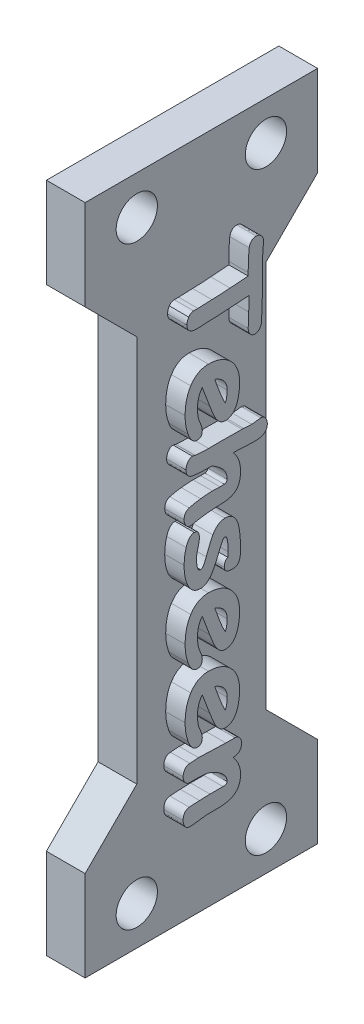
from build123d import *

# Parameters (mm, degrees)
SKETCH1_W           = 52.000002935
SKETCH1_H           = 18.000001088
SKETCH1_R           = 1.599502817
BOSS_EXTRUDE1_DEPTH = 2.999998629
CUT_EXTRUDE1_DEPTH  = 84.68851942
BOSS_EXTRUDE2_DEPTH = 1.5


with BuildPart() as part:
    # Sketch1 → Boss-Extrude1 (new body)
    with BuildSketch(Plane(origin=(120.988696814, 0, 0), x_dir=(0, -1, 0), z_dir=(-1, 0, 0))):
        with Locations((49.005120062, 27.999999933)):
            Rectangle(SKETCH1_W, SKETCH1_H)
        with Locations((26.005118371, 32.999999236)):
            Circle(SKETCH1_R, mode=Mode.SUBTRACT)
        with Locations((26.005118371, 23.000000115)):
            Circle(SKETCH1_R, mode=Mode.SUBTRACT)
        with Locations((72.005118202, 32.999999236)):
            Circle(SKETCH1_R, mode=Mode.SUBTRACT)
        with Locations((72.005118202, 23.000000115)):
            Circle(SKETCH1_R, mode=Mode.SUBTRACT)
    extrude(amount=-BOSS_EXTRUDE1_DEPTH)

    # Sketch2 → Cut-Extrude1 (cut, through all)
    with BuildSketch(Plane.ZY.offset(-120.988696814)):
        Polygon((37.000000477, -30.005120061), (33.000000477, -34.005120061), (33.000000477, -64.005120061), (37.000000477, -68.005120061), align=None)
        Polygon((22.999999389, -34.005120061), (18.999999389, -30.005120061), (18.999999389, -68.005120061), (22.999999389, -64.005120061), align=None)
    extrude(amount=-CUT_EXTRUDE1_DEPTH, mode=Mode.SUBTRACT)

    # Sketch3 → Boss-Extrude2 (add)
    # profile 1 of 7: a face of its own
    with BuildSketch(Plane(origin=(123.988695443, 0, 0), x_dir=(0, 0, -1), z_dir=(1, 0, 0))):
        with BuildLine():
            add(Edge.make_bspline(
                [(-25.874635313, -36.260907098), (-25.874205926, -36.229657838), (-25.873294149, -36.16330194), (-25.87278079, -36.057565161), (-25.868775399, -35.93952081), (-25.863851713, -35.809146126), (-25.859985542, -35.666726123), (-25.852394078, -35.512442631), (-25.844472389, -35.345768249), (-25.838420799, -35.230426294), (-25.835283461, -35.170629321)],
                knots=[0, 0, 0, 0, 0.687437344, 1.459731273, 2.325701463, 3.285246524, 4.329605122, 5.459422186, 6.682882883, 8, 8, 8, 8], degree=3))
            add(Edge.make_bspline(
                [(-25.835283461, -35.170629321), (-25.832003981, -35.112768078), (-25.82566519, -35.00093015), (-25.819590143, -34.838045222), (-25.811757617, -34.686107228), (-25.807540656, -34.544095442), (-25.803952562, -34.412924272), (-25.801629478, -34.292164653), (-25.80033263, -34.182206265), (-25.800487606, -34.112373418), (-25.800561239, -34.079194135)],
                knots=[0, 0, 0, 0, 1.273522573, 2.461546298, 3.581811178, 4.616695329, 5.583533482, 6.465419043, 7.270883288, 8, 8, 8, 8], degree=3))
            add(Edge.make_bspline(
                [(-25.800561239, -34.079194135), (-25.841461063, -34.080628406), (-25.930613, -34.083754777), (-26.074857967, -34.091331341), (-26.24122632, -34.098599608), (-26.429008076, -34.11125965), (-26.638999231, -34.122958166), (-26.870358836, -34.140251686), (-27.123902386, -34.15695384), (-27.30018277, -34.169751066), (-27.391996424, -34.176416358)],
                knots=[0, 0, 0, 0, 0.615983597, 1.34269844, 2.174098459, 3.122424446, 4.175436635, 5.339685182, 6.614404959, 8, 8, 8, 8], degree=3))
            add(Edge.make_bspline(
                [(-27.391996424, -34.176416358), (-27.474163087, -34.182342751), (-27.633837351, -34.193859495), (-27.866923527, -34.208356992), (-28.086735353, -34.223148755), (-28.293584284, -34.233084372), (-28.487253745, -34.241417181), (-28.667433868, -34.247168614), (-28.834495947, -34.250905945), (-28.94137738, -34.251407192), (-28.992690869, -34.251647839)],
                knots=[0, 0, 0, 0, 1.233537667, 2.397130592, 3.496937971, 4.532318174, 5.497915878, 6.399582772, 7.231644004, 8, 8, 8, 8], degree=3))
            add(Edge.make_bspline(
                [(-28.992690869, -34.251647839), (-29.017387332, -34.251856638), (-29.072603817, -34.252323471), (-29.163293825, -34.257457093), (-29.270565508, -34.265561608), (-29.388073202, -34.277453457), (-29.506160122, -34.287195826), (-29.612981628, -34.295592642), (-29.704057947, -34.300775025), (-29.759275159, -34.301216031), (-29.784357535, -34.301416358)],
                knots=[0, 0, 0, 0, 0.746886804, 1.669893565, 2.746515246, 4.000505021, 5.241835625, 6.330092717, 7.241445916, 8, 8, 8, 8], degree=3))
            add(Edge.make_bspline(
                [(-29.784357535, -34.301416358), (-29.832237136, -34.300594944), (-29.92550684, -34.298994826), (-30.061634581, -34.28459614), (-30.190746674, -34.262338826), (-30.272953609, -34.238862275), (-30.313292721, -34.227342284)],
                knots=[0, 0, 0, 0, 1.071519312, 2.087325055, 3.061446493, 4, 4, 4, 4], degree=3))
            add(Edge.make_bspline(
                [(-30.313292721, -34.227342284), (-30.337302202, -34.210579433), (-30.384390118, -34.177703768), (-30.445660528, -34.119116226), (-30.49865028, -34.056210653), (-30.541839283, -33.987780509), (-30.574184917, -33.913371432), (-30.598946462, -33.834780116), (-30.612835811, -33.75020783), (-30.614513986, -33.692283047), (-30.615376054, -33.662527469)],
                knots=[0, 0, 0, 0, 1.047704577, 2.054780917, 3.026327116, 3.988885098, 4.941768885, 5.925430569, 6.934307376, 8, 8, 8, 8], degree=3))
            add(Edge.make_bspline(
                [(-30.615376054, -33.662527469), (-30.613963569, -33.619569648), (-30.611188642, -33.535175983), (-30.585093945, -33.412968366), (-30.542188652, -33.298423399), (-30.500735648, -33.229486217), (-30.479959387, -33.194934876)],
                knots=[0, 0, 0, 0, 1.042770865, 2.048596809, 3.021955986, 4, 4, 4, 4], degree=3))
            add(Edge.make_bspline(
                [(-30.479959387, -33.194934876), (-30.454470779, -33.160338034), (-30.406221346, -33.094846893), (-30.312861745, -33.02218574), (-30.210129511, -32.975421559), (-30.137077199, -32.970539062), (-30.100329758, -32.968083024)],
                knots=[0, 0, 0, 0, 1.113628577, 2.108076944, 3.048307585, 4, 4, 4, 4], degree=3))
            add(Edge.make_bspline(
                [(-30.100329758, -32.968083024), (-30.077567412, -32.968083024), (-30.022783461, -32.968083024), (-29.935206301, -32.968083024), (-29.846857535, -32.968083024), (-29.790530375, -32.968083024), (-29.766996424, -32.968083024)],
                knots=[0, 0, 0, 0, 0.819444444, 1.972222222, 3.152777778, 4, 4, 4, 4], degree=3))
            add(Edge.make_bspline(
                [(-29.766996424, -32.968083024), (-29.733426862, -32.967896617), (-29.658930048, -32.967482947), (-29.535879322, -32.961928494), (-29.389998166, -32.955485869), (-29.228801759, -32.944939349), (-29.067222058, -32.934342003), (-28.920567009, -32.927940475), (-28.795973288, -32.922366225), (-28.720319149, -32.921967651), (-28.685977906, -32.921786728)],
                knots=[0, 0, 0, 0, 0.744434001, 1.65203115, 2.731327345, 3.982896076, 5.234464807, 6.322307542, 7.238454809, 8, 8, 8, 8], degree=3))
            add(Edge.make_bspline(
                [(-28.685977906, -32.921786728), (-28.64083706, -32.921544559), (-28.546685296, -32.921039459), (-28.399682939, -32.91732304), (-28.241107822, -32.911535411), (-28.071353817, -32.90329022), (-27.889968133, -32.89320928), (-27.697553549, -32.878542874), (-27.493013954, -32.863964499), (-27.353020274, -32.852475314), (-27.280885313, -32.846555247)],
                knots=[0, 0, 0, 0, 0.769722187, 1.605435146, 2.507300893, 3.475448232, 4.503413479, 5.604869268, 6.765853841, 8, 8, 8, 8], degree=3))
            add(Edge.make_bspline(
                [(-27.280885313, -32.846555247), (-27.199482626, -32.839595552), (-27.042870325, -32.826205652), (-26.818010166, -32.8072261), (-26.612267699, -32.792834741), (-26.426752738, -32.778574442), (-26.260855692, -32.766982477), (-26.114639845, -32.757623635), (-25.988096133, -32.750540361), (-25.910132871, -32.747324857), (-25.874635313, -32.745860802)],
                knots=[0, 0, 0, 0, 1.390685658, 2.675568704, 3.841071853, 4.901303653, 5.842688727, 6.6718063, 7.39525834, 8, 8, 8, 8], degree=3))
            Line((-25.874635313, -32.745860802), (-25.874635313, -32.507434876))
            add(Edge.make_bspline(
                [(-25.874635313, -32.507434876), (-25.874424342, -32.42448608), (-25.874013175, -32.262824722), (-25.870508189, -32.02708487), (-25.864814069, -31.804458983), (-25.856772431, -31.594947833), (-25.846530313, -31.398540096), (-25.833766041, -31.215262256), (-25.819188536, -31.045423222), (-25.806596419, -30.93680736), (-25.800561239, -30.884749691)],
                knots=[0, 0, 0, 0, 1.224866557, 2.387178614, 3.481371938, 4.513298365, 5.483143302, 6.385446865, 7.226173132, 8, 8, 8, 8], degree=3))
            add(Edge.make_bspline(
                [(-25.800561239, -30.884749691), (-25.790266346, -30.844750753), (-25.770609399, -30.768377254), (-25.728508771, -30.66320359), (-25.674309611, -30.574915851), (-25.611658687, -30.501108429), (-25.536760924, -30.444579232), (-25.45217783, -30.402988094), (-25.356521186, -30.380134271), (-25.289873469, -30.377072898), (-25.25542235, -30.375490432)],
                knots=[0, 0, 0, 0, 1.211690982, 2.313588465, 3.309882812, 4.240910251, 5.137774632, 6.044308989, 6.989076498, 8, 8, 8, 8], degree=3))
            add(Edge.make_bspline(
                [(-25.25542235, -30.375490432), (-25.220868127, -30.377566884), (-25.151978443, -30.381706642), (-25.051242323, -30.413288038), (-24.956221388, -30.466123266), (-24.900812373, -30.514808068), (-24.872320498, -30.539842284)],
                knots=[0, 0, 0, 0, 0.969469955, 1.932802232, 2.937026062, 4, 4, 4, 4], degree=3))
            add(Edge.make_bspline(
                [(-24.872320498, -30.539842284), (-24.841037823, -30.572766294), (-24.779272944, -30.637771843), (-24.720563993, -30.761053041), (-24.686027728, -30.89709248), (-24.688279849, -30.992552702), (-24.689450128, -31.042157098)],
                knots=[0, 0, 0, 0, 0.9804559, 1.935823513, 2.927383297, 4, 4, 4, 4], degree=3))
            add(Edge.make_bspline(
                [(-24.689450128, -31.042157098), (-24.690194043, -31.057590675), (-24.691886903, -31.092711483), (-24.695457208, -31.151735552), (-24.700099403, -31.22349434), (-24.705892936, -31.30798551), (-24.712949589, -31.405199107), (-24.72062387, -31.515218358), (-24.731845055, -31.637777334), (-24.738200177, -31.723858871), (-24.741533461, -31.76900895)],
                knots=[0, 0, 0, 0, 0.508864518, 1.157977419, 1.94737109, 2.877063254, 3.947064666, 5.157382339, 6.509036686, 8, 8, 8, 8], degree=3))
            add(Edge.make_bspline(
                [(-24.741533461, -31.76900895), (-24.747173054, -31.840751704), (-24.757870912, -31.97684201), (-24.769396998, -32.170156455), (-24.776984368, -32.341864919), (-24.778065242, -32.449172155), (-24.778570498, -32.499333024)],
                knots=[0, 0, 0, 0, 1.180615738, 2.239534302, 3.177068639, 4, 4, 4, 4], degree=3))
            add(Edge.make_bspline(
                [(-24.778570498, -32.499333024), (-24.778748924, -32.551417506), (-24.779146762, -32.667551259), (-24.775417136, -32.858890908), (-24.775774443, -33.084994174), (-24.771480489, -33.333822642), (-24.768026409, -33.582274771), (-24.766310919, -33.807979208), (-24.763013733, -33.998939371), (-24.763366148, -34.115072774), (-24.763524202, -34.167157098)],
                knots=[0, 0, 0, 0, 0.749439499, 1.671039394, 2.753577349, 4.002754204, 5.251931059, 6.328960606, 7.250560501, 8, 8, 8, 8], degree=3))
            add(Edge.make_bspline(
                [(-24.763524202, -34.167157098), (-24.763334849, -34.198023637), (-24.762934788, -34.26323787), (-24.766308978, -34.36622195), (-24.767556399, -34.480081585), (-24.77335831, -34.604637623), (-24.776876032, -34.740512283), (-24.784995469, -34.887036037), (-24.790748618, -35.044537015), (-24.801167763, -35.20877351), (-24.8080181, -35.373206741), (-24.81730738, -35.530523935), (-24.821913782, -35.677213318), (-24.828933544, -35.812942814), (-24.831261206, -35.937619969), (-24.835877034, -36.05138723), (-24.836235039, -36.154429392), (-24.837160286, -36.219627282), (-24.837598276, -36.250490432)],
                knots=[0, 0, 0, 0, 0.710584785, 1.501309937, 2.371957552, 3.331904735, 4.371742144, 5.501053699, 6.710222863, 8.000116531, 9.289551385, 10.499144584, 11.628071836, 12.668250616, 13.627910102, 14.498784229, 15.289359702, 16, 16, 16, 16], degree=3))
            add(Edge.make_bspline(
                [(-24.837598276, -36.250490432), (-24.83929639, -36.294226652), (-24.842594439, -36.379170456), (-24.870462987, -36.501375975), (-24.919118448, -36.611728762), (-24.983070097, -36.709713388), (-25.061021316, -36.791357438), (-25.150736289, -36.850692138), (-25.249584341, -36.887708098), (-25.318766329, -36.891890744), (-25.35380198, -36.89400895)],
                knots=[0, 0, 0, 0, 1.144660912, 2.223142522, 3.259378561, 4.287900578, 5.274003961, 6.193231436, 7.085002975, 8, 8, 8, 8], degree=3))
            add(Edge.make_bspline(
                [(-25.35380198, -36.89400895), (-25.389208999, -36.891846487), (-25.458620111, -36.887607244), (-25.558130103, -36.851722161), (-25.648895991, -36.793891454), (-25.727341556, -36.713351411), (-25.793973206, -36.618066749), (-25.839600605, -36.508124513), (-25.870300184, -36.388343512), (-25.873158412, -36.304322412), (-25.874635313, -36.260907098)],
                knots=[0, 0, 0, 0, 0.929953715, 1.82306003, 2.750179954, 3.741416948, 4.76421421, 5.792595484, 6.859391737, 8, 8, 8, 8], degree=3))
        make_face()
    # profile 2 of 7: a face of its own
    with BuildSketch(Plane(origin=(123.988695443, 0, 0), x_dir=(0, 0, -1), z_dir=(1, 0, 0))):
        with BuildLine():
            add(Edge.make_bspline(
                [(-30.763524202, -39.665999691), (-30.762228609, -39.5772261), (-30.759690034, -39.403283873), (-30.738756739, -39.148915261), (-30.703729079, -38.907088268), (-30.657235521, -38.676989443), (-30.594463599, -38.459787827), (-30.519306353, -38.254325117), (-30.42952772, -38.061718215), (-30.357902176, -37.941679161), (-30.32255198, -37.882434876)],
                knots=[0, 0, 0, 0, 1.144288191, 2.242108657, 3.287295793, 4.292934211, 5.26575387, 6.198873564, 7.111068903, 8, 8, 8, 8], degree=3))
            add(Edge.make_bspline(
                [(-30.32255198, -37.882434876), (-30.281029051, -37.821665199), (-30.200021035, -37.70310827), (-30.059369951, -37.545418894), (-29.904445213, -37.413510925), (-29.738644445, -37.302952679), (-29.557909475, -37.219466204), (-29.365842559, -37.159114772), (-29.161156847, -37.12219078), (-29.020624791, -37.118248554), (-28.948709387, -37.116231172)],
                knots=[0, 0, 0, 0, 1.071182492, 2.089794003, 3.066105241, 4.027624015, 4.982801498, 5.954835054, 6.953414149, 8, 8, 8, 8], degree=3))
            add(Edge.make_bspline(
                [(-28.948709387, -37.116231172), (-28.868756805, -37.117861849), (-28.711012258, -37.121079136), (-28.479449538, -37.150959692), (-28.257122025, -37.198239785), (-28.044118697, -37.264160511), (-27.84105996, -37.350082686), (-27.647503382, -37.455398264), (-27.462632465, -37.578546149), (-27.349411894, -37.675233924), (-27.292459387, -37.723870061)],
                knots=[0, 0, 0, 0, 1.062196923, 2.095689323, 3.097362776, 4.080170035, 5.054419591, 6.022645971, 7.005346216, 8, 8, 8, 8], degree=3))
            add(Edge.make_bspline(
                [(-27.292459387, -37.723870061), (-27.232473835, -37.781629799), (-27.113716975, -37.895980086), (-26.960174154, -38.088746716), (-26.831100687, -38.296618506), (-26.724019286, -38.518281481), (-26.641246205, -38.755140908), (-26.58461505, -39.006857552), (-26.547099857, -39.27289981), (-26.543264636, -39.455603715), (-26.54130198, -39.549101543)],
                knots=[0, 0, 0, 0, 0.98097412, 1.942091084, 2.896251481, 3.860549038, 4.838745849, 5.847205768, 6.89831811, 8, 8, 8, 8], degree=3))
            add(Edge.make_bspline(
                [(-26.54130198, -39.549101543), (-26.541901633, -39.613934895), (-26.54307676, -39.740987293), (-26.554224353, -39.927008347), (-26.569358722, -40.105212932), (-26.594448528, -40.274536544), (-26.623244362, -40.436058047), (-26.662767803, -40.588158204), (-26.705181367, -40.732946502), (-26.741255851, -40.824794202), (-26.758894572, -40.869703395)],
                knots=[0, 0, 0, 0, 1.155258516, 2.263932973, 3.320270398, 4.341221546, 5.313483044, 6.2423042, 7.140569667, 8, 8, 8, 8], degree=3))
            add(Edge.make_bspline(
                [(-26.758894572, -40.869703395), (-26.783062804, -40.924372934), (-26.829460128, -41.029325601), (-26.917329517, -41.170707413), (-27.014392202, -41.291151948), (-27.121758306, -41.390024392), (-27.239734102, -41.46715677), (-27.36821158, -41.521639845), (-27.506793671, -41.55531857), (-27.602452041, -41.558865844), (-27.651255683, -41.560675617)],
                knots=[0, 0, 0, 0, 1.189323331, 2.283221273, 3.304512514, 4.261791763, 5.178263178, 6.097436537, 7.029337149, 8, 8, 8, 8], degree=3))
            add(Edge.make_bspline(
                [(-27.651255683, -41.560675617), (-27.686498872, -41.558687441), (-27.75711172, -41.554703954), (-27.861533984, -41.528653666), (-27.961974281, -41.483596261), (-28.058875074, -41.421326421), (-28.151852592, -41.341171034), (-28.242205068, -41.244564522), (-28.329236121, -41.13019036), (-28.381893479, -41.045709705), (-28.409357535, -41.001647839)],
                knots=[0, 0, 0, 0, 0.857394917, 1.71786662, 2.600324258, 3.52461547, 4.510071692, 5.579096893, 6.737349876, 8, 8, 8, 8], degree=3))
            add(Edge.make_bspline(
                [(-28.409357535, -41.001647839), (-28.423084532, -40.977849932), (-28.453021916, -40.925948771), (-28.496869443, -40.837999484), (-28.544837075, -40.734283655), (-28.598527148, -40.614474877), (-28.655912723, -40.478602116), (-28.71719301, -40.32640105), (-28.783206987, -40.158585403), (-28.828062343, -40.041041878), (-28.851487165, -39.979657098)],
                knots=[0, 0, 0, 0, 0.591478089, 1.28996216, 2.115057335, 3.052201513, 4.116876335, 5.290872148, 6.585211602, 8, 8, 8, 8], degree=3))
            Line((-28.851487165, -39.979657098), (-29.430190869, -38.449564506))
            add(Edge.make_bspline(
                [(-29.430190869, -38.449564506), (-29.459988952, -38.487142904), (-29.520028995, -38.562859475), (-29.595506038, -38.689673861), (-29.65876073, -38.827624375), (-29.711069328, -38.976798029), (-29.751194005, -39.136852524), (-29.779997676, -39.308275999), (-29.797427255, -39.490868681), (-29.799498848, -39.616577709), (-29.800561239, -39.681045987)],
                knots=[0, 0, 0, 0, 0.875974076, 1.764996822, 2.689592788, 3.646521728, 4.650630478, 5.70228572, 6.821646415, 8, 8, 8, 8], degree=3))
            add(Edge.make_bspline(
                [(-29.800561239, -39.681045987), (-29.798099447, -39.77839191), (-29.7933436, -39.966450934), (-29.757555369, -40.236838164), (-29.698319236, -40.485192564), (-29.635449204, -40.636568848), (-29.604959387, -40.709981172)],
                knots=[0, 0, 0, 0, 1.106819765, 2.138224568, 3.097102532, 4, 4, 4, 4], degree=3))
            add(Edge.make_bspline(
                [(-29.604959387, -40.709981172), (-29.578445183, -40.768992034), (-29.528860744, -40.87934875), (-29.474875639, -41.039788042), (-29.437112807, -41.18123977), (-29.43236842, -41.270750094), (-29.430190869, -41.311833024)],
                knots=[0, 0, 0, 0, 1.229450502, 2.299205913, 3.219379362, 4, 4, 4, 4], degree=3))
            add(Edge.make_bspline(
                [(-29.430190869, -41.311833024), (-29.431036173, -41.348584348), (-29.432632563, -41.417990682), (-29.451307314, -41.514728594), (-29.480465235, -41.597963142), (-29.524453386, -41.66581043), (-29.579891406, -41.719696504), (-29.648477553, -41.757643409), (-29.729373932, -41.779825326), (-29.787295071, -41.781835113), (-29.81792235, -41.782897839)],
                knots=[0, 0, 0, 0, 1.263036124, 2.385293837, 3.376702854, 4.278935312, 5.142842145, 6.010718644, 6.948116733, 8, 8, 8, 8], degree=3))
            add(Edge.make_bspline(
                [(-29.81792235, -41.782897839), (-29.854119586, -41.780810135), (-29.926422922, -41.776639984), (-30.031145857, -41.737869662), (-30.12942183, -41.676365928), (-30.221515098, -41.590687259), (-30.308619527, -41.48251963), (-30.390484784, -41.350620328), (-30.466406269, -41.194680486), (-30.510165905, -41.081106766), (-30.533200128, -41.021323765)],
                knots=[0, 0, 0, 0, 0.779424823, 1.556887254, 2.380114875, 3.270797805, 4.259886207, 5.371943043, 6.616641856, 8, 8, 8, 8], degree=3))
            add(Edge.make_bspline(
                [(-30.533200128, -41.021323765), (-30.568899927, -40.913887946), (-30.640588212, -40.698147526), (-30.709771397, -40.361947025), (-30.756483261, -40.017246375), (-30.761162223, -39.783830158), (-30.763524202, -39.665999691)],
                knots=[0, 0, 0, 0, 0.982723291, 1.973393384, 2.976951957, 4, 4, 4, 4], degree=3))
        make_face()
        with BuildLine():
            add(Edge.make_bspline(
                [(-27.504264943, -39.580351543), (-27.504782483, -39.545589029), (-27.505797616, -39.477403754), (-27.518218228, -39.377275211), (-27.53609445, -39.280681222), (-27.563325708, -39.18801425), (-27.596230809, -39.098468018), (-27.638802606, -39.013794482), (-27.686915614, -38.932179177), (-27.74452308, -38.855859215), (-27.808256441, -38.782264064), (-27.880402256, -38.713159626), (-27.959424651, -38.646713329), (-28.046109772, -38.584468449), (-28.140620216, -38.526339279), (-28.242509321, -38.472359669), (-28.351644186, -38.420891359), (-28.428075461, -38.390869391), (-28.467227906, -38.375490432)],
                knots=[0, 0, 0, 0, 1.007052558, 1.975293128, 2.92059301, 3.85149459, 4.771653469, 5.681905021, 6.594831873, 7.514106867, 8.449364585, 9.414240951, 10.406530947, 11.440060377, 12.504587061, 13.620282066, 14.780973179, 16, 16, 16, 16], degree=3))
            add(Edge.make_bspline(
                [(-28.467227906, -38.375490432), (-28.403848528, -38.546361182), (-28.277434384, -38.887173612), (-28.152306487, -39.228460378), (-28.089913091, -39.39863858)],
                knots=[0, 0, 0, 0, 1.002726044, 2, 2, 2, 2], degree=3))
            add(Edge.make_bspline(
                [(-28.089913091, -39.39863858), (-28.051907815, -39.495710196), (-27.979437552, -39.680810959), (-27.86740018, -39.940529036), (-27.760401222, -40.169834258), (-27.686125688, -40.309787044), (-27.651255683, -40.375490432)],
                knots=[0, 0, 0, 0, 1.167330686, 2.225921541, 3.167126514, 4, 4, 4, 4], degree=3))
            add(Edge.make_bspline(
                [(-27.651255683, -40.375490432), (-27.627981314, -40.321268015), (-27.579448427, -40.208200703), (-27.537262044, -40.018373377), (-27.508692632, -39.807325747), (-27.505787491, -39.658401096), (-27.504264943, -39.580351543)],
                knots=[0, 0, 0, 0, 0.867250517, 1.808434411, 2.851427803, 4, 4, 4, 4], degree=3))
        make_face(mode=Mode.SUBTRACT)
    # profile 3 of 7: a face of its own
    with BuildSketch(Plane(origin=(123.988695443, 0, 0), x_dir=(0, 0, -1), z_dir=(1, 0, 0))):
        with BuildLine():
            add(Edge.make_bspline(
                [(-27.026255683, -44.005120061), (-26.981268692, -44.061085483), (-26.892748205, -44.171208125), (-26.778440715, -44.347941436), (-26.682658607, -44.530695494), (-26.603398331, -44.719168037), (-26.541118108, -44.913428577), (-26.499381126, -45.114844903), (-26.471105366, -45.322217801), (-26.468529017, -45.462971597), (-26.467227906, -45.534055247)],
                knots=[0, 0, 0, 0, 1.035675271, 2.037888643, 3.031529294, 4.009685975, 4.985145426, 5.970091544, 6.974853214, 8, 8, 8, 8], degree=3))
            add(Edge.make_bspline(
                [(-26.467227906, -45.534055247), (-26.468297946, -45.59697568), (-26.47036366, -45.718443718), (-26.487274821, -45.893911636), (-26.517728367, -46.055137901), (-26.557374993, -46.203696494), (-26.6106274, -46.337876412), (-26.674704202, -46.459076783), (-26.750712391, -46.566949001), (-26.811985887, -46.627843084), (-26.842227906, -46.657897839)],
                knots=[0, 0, 0, 0, 1.238845407, 2.39159382, 3.465849618, 4.466598421, 5.414574722, 6.301601902, 7.161742201, 8, 8, 8, 8], degree=3))
            add(Edge.make_bspline(
                [(-26.842227906, -46.657897839), (-26.866876968, -46.67889919), (-26.916796282, -46.721431154), (-27.001480334, -46.776239752), (-27.095800759, -46.82322266), (-27.199179187, -46.864881455), (-27.312165178, -46.90074694), (-27.434341605, -46.930490093), (-27.566141087, -46.954026345), (-27.65734846, -46.963292867), (-27.704496424, -46.968083024)],
                knots=[0, 0, 0, 0, 0.833299679, 1.687599639, 2.589619994, 3.543502374, 4.55529011, 5.639697267, 6.779885176, 8, 8, 8, 8], degree=3))
            add(Edge.make_bspline(
                [(-27.704496424, -46.968083024), (-27.864613212, -46.975230986), (-28.185653751, -46.989562935), (-28.506588609, -47.006093342), (-28.667459387, -47.014379321)],
                knots=[0, 0, 0, 0, 0.997486407, 2, 2, 2, 2], degree=3))
            add(Edge.make_bspline(
                [(-28.667459387, -47.014379321), (-28.717235825, -47.019708617), (-28.81178975, -47.029831998), (-28.9455775, -47.045271803), (-29.06448641, -47.057642488), (-29.167800189, -47.069580173), (-29.255844409, -47.078470975), (-29.32837411, -47.08661077), (-29.385406046, -47.093743014), (-29.418613204, -47.097357791), (-29.432505683, -47.098870061)],
                knots=[0, 0, 0, 0, 1.560938152, 2.965114311, 4.199254207, 5.288586217, 6.207891516, 6.958469016, 7.564267196, 8, 8, 8, 8], degree=3))
            add(Edge.make_bspline(
                [(-29.432505683, -47.098870061), (-29.502394512, -47.108909258), (-29.638209583, -47.128418445), (-29.834330112, -47.162934205), (-30.016829753, -47.201150958), (-30.133195692, -47.229730072), (-30.189450128, -47.243545987)],
                knots=[0, 0, 0, 0, 1.098790867, 2.13528202, 3.09854499, 4, 4, 4, 4], degree=3))
            add(Edge.make_bspline(
                [(-30.189450128, -47.243545987), (-30.215195066, -47.249304527), (-30.26289978, -47.259974955), (-30.31167397, -47.262990968), (-30.334126054, -47.264379321)],
                knots=[0, 0, 0, 0, 1.079345675, 2, 2, 2, 2], degree=3))
            add(Edge.make_bspline(
                [(-30.334126054, -47.264379321), (-30.369161915, -47.261862915), (-30.438072239, -47.25691352), (-30.536656759, -47.219157993), (-30.623956327, -47.155273615), (-30.699180456, -47.06924729), (-30.760366024, -46.967819914), (-30.805087295, -46.855599678), (-30.832332148, -46.735196327), (-30.835817312, -46.651868387), (-30.837598276, -46.609286728)],
                knots=[0, 0, 0, 0, 0.917293682, 1.804180121, 2.72503742, 3.728190044, 4.781365222, 5.816504238, 6.884205326, 8, 8, 8, 8], degree=3))
            add(Edge.make_bspline(
                [(-30.837598276, -46.609286728), (-30.836682384, -46.572165904), (-30.834923688, -46.500886461), (-30.816094338, -46.398714535), (-30.784923335, -46.306655932), (-30.74219491, -46.224492132), (-30.686317175, -46.153234326), (-30.617914117, -46.092653654), (-30.537844296, -46.040770856), (-30.477378643, -46.017198903), (-30.446394572, -46.005120061)],
                knots=[0, 0, 0, 0, 1.149180986, 2.206658446, 3.204692444, 4.151208709, 5.062337215, 5.993556009, 6.971849347, 8, 8, 8, 8], degree=3))
            add(Edge.make_bspline(
                [(-30.446394572, -46.005120061), (-30.388259199, -45.98994724), (-30.261879333, -45.956963206), (-30.054714984, -45.915365256), (-29.815437552, -45.874653855), (-29.644782422, -45.851776337), (-29.554033461, -45.839610802)],
                knots=[0, 0, 0, 0, 0.793669685, 1.725350036, 2.790413624, 4, 4, 4, 4], degree=3))
            add(Edge.make_bspline(
                [(-29.554033461, -45.839610802), (-29.466110996, -45.829209985), (-29.298926336, -45.809432819), (-29.059725943, -45.786937154), (-28.845079956, -45.773628386), (-28.709912783, -45.771270395), (-28.646626054, -45.770166358)],
                knots=[0, 0, 0, 0, 1.166747919, 2.21857239, 3.165916376, 4, 4, 4, 4], degree=3))
            add(Edge.make_bspline(
                [(-28.646626054, -45.770166358), (-28.628494469, -45.770597326), (-28.587603839, -45.771569252), (-28.520046885, -45.772036259), (-28.439826139, -45.776203608), (-28.351487165, -45.780583024), (-28.263148191, -45.784962441), (-28.182927445, -45.78912979), (-28.115370491, -45.789596797), (-28.074479861, -45.790568723), (-28.056348276, -45.790999691)],
                knots=[0, 0, 0, 0, 0.736889362, 1.661844212, 2.744437524, 4, 5.255562476, 6.338155788, 7.263110638, 8, 8, 8, 8], degree=3))
            add(Edge.make_bspline(
                [(-28.056348276, -45.790999691), (-28.013131298, -45.791339307), (-27.936720882, -45.79193977), (-27.837232445, -45.788571734), (-27.768038914, -45.787832866), (-27.732265635, -45.784192537), (-27.719542721, -45.782897839)],
                knots=[0, 0, 0, 0, 1.538500319, 2.720168191, 3.54482255, 4, 4, 4, 4], degree=3))
            add(Edge.make_bspline(
                [(-27.719542721, -45.782897839), (-27.687599119, -45.774794678), (-27.62846125, -45.759793123), (-27.553969123, -45.709914318), (-27.511283711, -45.634425563), (-27.506688101, -45.578558793), (-27.504264943, -45.549101543)],
                knots=[0, 0, 0, 0, 1.128472321, 2.089164756, 2.992460934, 4, 4, 4, 4], degree=3))
            add(Edge.make_bspline(
                [(-27.504264943, -45.549101543), (-27.505160088, -45.508118247), (-27.506944156, -45.426436518), (-27.528085006, -45.305581107), (-27.559127797, -45.18738011), (-27.601705724, -45.071579769), (-27.659744835, -44.960411084), (-27.727848495, -44.851070798), (-27.809523388, -44.745066898), (-27.871733564, -44.678984801), (-27.903570498, -44.645166358)],
                knots=[0, 0, 0, 0, 0.968434895, 1.930138472, 2.8930537, 3.857567702, 4.841191313, 5.854016332, 6.901762619, 8, 8, 8, 8], degree=3))
            add(Edge.make_bspline(
                [(-27.903570498, -44.645166358), (-27.921882974, -44.626815023), (-27.960864027, -44.587751256), (-28.028199497, -44.529585667), (-28.106457676, -44.466666401), (-28.195725258, -44.397984749), (-28.29688908, -44.325832138), (-28.40750892, -44.246043851), (-28.531944847, -44.165067969), (-28.618097652, -44.108542953), (-28.662829758, -44.079194135)],
                knots=[0, 0, 0, 0, 0.655710444, 1.395785196, 2.24943897, 3.196273845, 4.244716548, 5.392995699, 6.646395906, 8, 8, 8, 8], degree=3))
            add(Edge.make_bspline(
                [(-28.662829758, -44.079194135), (-28.7203132, -44.078742213), (-28.832579644, -44.0778596), (-28.996573214, -44.077675543), (-29.151633902, -44.073138064), (-29.297916394, -44.070831188), (-29.435196863, -44.06396786), (-29.564163549, -44.059337125), (-29.683660908, -44.050262934), (-29.794934123, -44.043191854), (-29.897017404, -44.031839488), (-29.991039602, -44.022657215), (-30.075303733, -44.008948039), (-30.151301751, -43.997288869), (-30.217794284, -43.981572995), (-30.276556126, -43.967331237), (-30.325916238, -43.950072595), (-30.355415098, -43.936999299), (-30.368848276, -43.931045987)],
                knots=[0, 0, 0, 0, 1.604117689, 3.132877622, 4.575835951, 5.932692041, 7.214934509, 8.411133178, 9.53329385, 10.558803062, 11.521832255, 12.399216061, 13.193980506, 13.90369723, 14.543597064, 15.099775909, 15.590056335, 16, 16, 16, 16], degree=3))
            add(Edge.make_bspline(
                [(-30.368848276, -43.931045987), (-30.394367657, -43.915087981), (-30.444037874, -43.88402776), (-30.510166753, -43.827389258), (-30.565615809, -43.763660513), (-30.611729736, -43.693374464), (-30.646348637, -43.615820753), (-30.67185291, -43.532305208), (-30.687343161, -43.441648836), (-30.688730679, -43.379026056), (-30.689450128, -43.346555247)],
                knots=[0, 0, 0, 0, 1.02847849, 2.001802125, 2.965144535, 3.909499368, 4.866220788, 5.859731927, 6.890240311, 8, 8, 8, 8], degree=3))
            add(Edge.make_bspline(
                [(-30.689450128, -43.346555247), (-30.687665332, -43.303590147), (-30.684172319, -43.219503443), (-30.656788218, -43.097101013), (-30.611085427, -42.98224271), (-30.548428121, -42.87732382), (-30.472857583, -42.787313675), (-30.385824973, -42.719892872), (-30.288476989, -42.678869053), (-30.220301732, -42.674158383), (-30.185977906, -42.671786728)],
                knots=[0, 0, 0, 0, 1.109774882, 2.171932909, 3.22374194, 4.2926196, 5.318002338, 6.24342237, 7.115625424, 8, 8, 8, 8], degree=3))
            add(Edge.make_bspline(
                [(-30.185977906, -42.671786728), (-30.172436118, -42.672641163), (-30.142790985, -42.674511659), (-30.095256549, -42.684686344), (-30.040228646, -42.699702999), (-30.001844275, -42.713892789), (-29.981116795, -42.721555247)],
                knots=[0, 0, 0, 0, 0.768204573, 1.681722394, 2.748134909, 4, 4, 4, 4], degree=3))
            add(Edge.make_bspline(
                [(-29.981116795, -42.721555247), (-29.969587585, -42.72451064), (-29.937724291, -42.732678464), (-29.874610306, -42.737149141), (-29.784852548, -42.744662284), (-29.667476244, -42.75107059), (-29.523225957, -42.758320686), (-29.351493026, -42.763512975), (-29.152426021, -42.769446625), (-29.010440037, -42.772937044), (-28.934820498, -42.774795987)],
                knots=[0, 0, 0, 0, 0.272042877, 0.751845291, 1.442689248, 2.336181115, 3.441312714, 4.749029402, 6.268583346, 8, 8, 8, 8], degree=3))
            add(Edge.make_bspline(
                [(-28.934820498, -42.774795987), (-28.864606493, -42.773159829), (-28.713387621, -42.769636059), (-28.470326093, -42.766051724), (-28.194851981, -42.765494427), (-27.887362444, -42.76501737), (-27.547472351, -42.767992497), (-27.175548022, -42.770951064), (-26.770850363, -42.777263975), (-26.490375731, -42.781732061), (-26.344542721, -42.784055247)],
                knots=[0, 0, 0, 0, 0.650688059, 1.401377299, 2.252079145, 3.202855169, 4.250162932, 5.40115228, 6.648727033, 8, 8, 8, 8], degree=3))
            Line((-26.344542721, -42.784055247), (-26.217227906, -42.793314506))
            add(Edge.make_bspline(
                [(-26.217227906, -42.793314506), (-26.180572747, -42.795173621), (-26.110724929, -42.798716237), (-26.010459995, -42.804898341), (-25.91979356, -42.809557809), (-25.838354121, -42.812640052), (-25.766629991, -42.816528063), (-25.704508742, -42.818760503), (-25.651647765, -42.820156896), (-25.619620507, -42.820004595), (-25.604959387, -42.819934876)],
                knots=[0, 0, 0, 0, 1.437132368, 2.738511077, 3.933477105, 4.991923815, 5.929641239, 6.745967762, 7.425941598, 8, 8, 8, 8], degree=3))
            add(Edge.make_bspline(
                [(-25.604959387, -42.819934876), (-25.582570939, -42.819390004), (-25.532694592, -42.818176152), (-25.451240564, -42.810653977), (-25.355549874, -42.798894528), (-25.25079048, -42.782917561), (-25.145665306, -42.766769621), (-25.049941942, -42.755307131), (-24.968510046, -42.747569917), (-24.919015619, -42.746393137), (-24.896626054, -42.745860802)],
                knots=[0, 0, 0, 0, 0.75389209, 1.679499295, 2.752605371, 4.0000238, 5.24744223, 6.33344433, 7.24610791, 8, 8, 8, 8], degree=3))
            add(Edge.make_bspline(
                [(-24.896626054, -42.745860802), (-24.861223993, -42.747984428), (-24.791693097, -42.752155303), (-24.692511585, -42.78851414), (-24.604968655, -42.849735724), (-24.530661787, -42.932580486), (-24.470402212, -43.03064798), (-24.423647995, -43.139431171), (-24.398846562, -43.259424361), (-24.395086127, -43.342210252), (-24.393153832, -43.384749691)],
                knots=[0, 0, 0, 0, 0.937044461, 1.840388389, 2.7602814, 3.745558583, 4.770854731, 5.803075883, 6.87111297, 8, 8, 8, 8], degree=3))
            add(Edge.make_bspline(
                [(-24.393153832, -43.384749691), (-24.39391143, -43.421132762), (-24.395366672, -43.491019594), (-24.41637184, -43.590912531), (-24.446952756, -43.682183263), (-24.491142036, -43.764404022), (-24.549533987, -43.836127007), (-24.619315027, -43.899342486), (-24.703220786, -43.951837808), (-24.765053155, -43.978549191), (-24.797089017, -43.99238858)],
                knots=[0, 0, 0, 0, 1.11332703, 2.138546818, 3.114773289, 4.056799468, 4.982196383, 5.936907375, 6.931094653, 8, 8, 8, 8], degree=3))
            add(Edge.make_bspline(
                [(-24.797089017, -43.99238858), (-24.840025574, -44.006240064), (-24.934409149, -44.036688537), (-25.096204938, -44.06007054), (-25.287086641, -44.076370713), (-25.424737148, -44.078209226), (-25.498477906, -44.079194135)],
                knots=[0, 0, 0, 0, 0.761494838, 1.673925654, 2.753898637, 4, 4, 4, 4], degree=3))
            add(Edge.make_bspline(
                [(-25.498477906, -44.079194135), (-25.626635334, -44.077598558), (-25.8851719, -44.074379742), (-26.142841521, -44.052959338), (-26.272783461, -44.042157098)],
                knots=[0, 0, 0, 0, 0.991406601, 2, 2, 2, 2], degree=3))
            add(Edge.make_bspline(
                [(-26.272783461, -44.042157098), (-26.398479314, -44.031354652), (-26.649185098, -44.009808709), (-26.900794953, -44.006680091), (-27.026255683, -44.005120061)],
                knots=[0, 0, 0, 0, 1.002735963, 2, 2, 2, 2], degree=3))
        make_face()
    # profile 4 of 7: a face of its own
    with BuildSketch(Plane(origin=(123.988695443, 0, 0), x_dir=(0, 0, -1), z_dir=(1, 0, 0))):
        with BuildLine():
            add(Edge.make_bspline(
                [(-27.726487165, -51.350027469), (-27.725619363, -51.314872638), (-27.723972785, -51.248169382), (-27.711242079, -51.153916967), (-27.691104616, -51.070302522), (-27.660673407, -50.997876121), (-27.622803587, -50.93502083), (-27.574386729, -50.884489612), (-27.517609949, -50.844968346), (-27.474974038, -50.828361697), (-27.453339017, -50.819934876)],
                knots=[0, 0, 0, 0, 1.316740999, 2.498402399, 3.557228592, 4.529100504, 5.4316286, 6.290498072, 7.132536173, 8, 8, 8, 8], degree=3))
            add(Edge.make_bspline(
                [(-27.453339017, -50.819934876), (-27.446587576, -50.757880247), (-27.432985364, -50.632858017), (-27.431126891, -50.507110408), (-27.430190869, -50.443777469)],
                knots=[0, 0, 0, 0, 0.992697521, 2, 2, 2, 2], degree=3))
            add(Edge.make_bspline(
                [(-27.430190869, -50.443777469), (-27.430547188, -50.399025523), (-27.431235298, -50.312602377), (-27.432712776, -50.187149387), (-27.439066753, -50.07065532), (-27.446119461, -49.962644535), (-27.453148213, -49.86326793), (-27.465574963, -49.772739044), (-27.477576406, -49.690730836), (-27.492548592, -49.617279356), (-27.510115851, -49.552525497), (-27.527939878, -49.49569579), (-27.548445165, -49.447685234), (-27.571902689, -49.40908549), (-27.596146253, -49.37798518), (-27.622908486, -49.355025642), (-27.653185685, -49.341359892), (-27.674277918, -49.33942201), (-27.684820498, -49.338453395)],
                knots=[0, 0, 0, 0, 1.80168657, 3.479344157, 5.049916731, 6.497321591, 7.83742239, 9.058771599, 10.174642918, 11.173723132, 12.074131187, 12.8747041, 13.570148323, 14.16945962, 14.688536519, 15.151876865, 15.576080639, 16, 16, 16, 16], degree=3))
            add(Edge.make_bspline(
                [(-27.684820498, -49.338453395), (-27.698310643, -49.341028005), (-27.729145953, -49.346912961), (-27.77241449, -49.381461067), (-27.817125181, -49.433792403), (-27.865132541, -49.506903963), (-27.917974456, -49.599064865), (-27.973388148, -49.712053783), (-28.030414472, -49.84556141), (-28.069248575, -49.941393912), (-28.089913091, -49.99238858)],
                knots=[0, 0, 0, 0, 0.412199299, 0.942190982, 1.631274859, 2.508935052, 3.590469172, 4.858869863, 6.328532745, 8, 8, 8, 8], degree=3))
            add(Edge.make_bspline(
                [(-28.089913091, -49.99238858), (-28.118298339, -50.063828258), (-28.17287448, -50.201184888), (-28.253878097, -50.397418796), (-28.329171844, -50.576189126), (-28.399060809, -50.73720936), (-28.466313568, -50.879216758), (-28.528066635, -51.003234565), (-28.582258017, -51.110589018), (-28.620801882, -51.173918211), (-28.638524202, -51.203036728)],
                knots=[0, 0, 0, 0, 1.386651094, 2.666105534, 3.82939407, 4.885789616, 5.832179655, 6.663169623, 7.38533057, 8, 8, 8, 8], degree=3))
            add(Edge.make_bspline(
                [(-28.638524202, -51.203036728), (-28.672024428, -51.254543623), (-28.736514638, -51.353697894), (-28.84298993, -51.487458456), (-28.953443852, -51.600318752), (-29.065897507, -51.694967223), (-29.183440342, -51.767247171), (-29.303793282, -51.81911695), (-29.427797165, -51.850839344), (-29.511800267, -51.854920221), (-29.554033461, -51.856971913)],
                knots=[0, 0, 0, 0, 1.253506736, 2.413085595, 3.482116636, 4.472111004, 5.40523938, 6.287132302, 7.138842827, 8, 8, 8, 8], degree=3))
            add(Edge.make_bspline(
                [(-29.554033461, -51.856971913), (-29.607870579, -51.8548772), (-29.71362557, -51.850762448), (-29.866562545, -51.814456187), (-30.010433658, -51.758068523), (-30.142117931, -51.674707806), (-30.265497273, -51.570841936), (-30.376057022, -51.441658683), (-30.477929113, -51.290976924), (-30.534084698, -51.179067756), (-30.563292721, -51.120860802)],
                knots=[0, 0, 0, 0, 0.97280942, 1.910939085, 2.828693886, 3.756587014, 4.717426273, 5.736592043, 6.822740946, 8, 8, 8, 8], degree=3))
            add(Edge.make_bspline(
                [(-30.563292721, -51.120860802), (-30.585633493, -51.070231023), (-30.630886354, -50.96767672), (-30.685947344, -50.80612528), (-30.731807376, -50.636166966), (-30.77156196, -50.458305918), (-30.801439319, -50.271609632), (-30.821809369, -50.076471307), (-30.834821824, -49.872965659), (-30.83666136, -49.73430684), (-30.837598276, -49.663684876)],
                knots=[0, 0, 0, 0, 0.888560347, 1.799843689, 2.73793428, 3.715240647, 4.725869516, 5.772909381, 6.865694117, 8, 8, 8, 8], degree=3))
            add(Edge.make_bspline(
                [(-30.837598276, -49.663684876), (-30.835486087, -49.56407463), (-30.831342667, -49.368672128), (-30.802098384, -49.081954981), (-30.75378799, -48.807934449), (-30.703668742, -48.632847698), (-30.679033461, -48.546786728)],
                knots=[0, 0, 0, 0, 1.055639814, 2.070817708, 3.051742639, 4, 4, 4, 4], degree=3))
            add(Edge.make_bspline(
                [(-30.679033461, -48.546786728), (-30.660642893, -48.492442678), (-30.625809815, -48.389511082), (-30.562506239, -48.24821027), (-30.491624754, -48.129113981), (-30.415754734, -48.029815452), (-30.331234869, -47.953164229), (-30.240750941, -47.89683476), (-30.142441099, -47.862601884), (-30.074354713, -47.858854695), (-30.040144572, -47.856971913)],
                knots=[0, 0, 0, 0, 1.36618555, 2.587655153, 3.679869254, 4.66160461, 5.553030586, 6.382064684, 7.187065184, 8, 8, 8, 8], degree=3))
            add(Edge.make_bspline(
                [(-30.040144572, -47.856971913), (-30.009422726, -47.858102941), (-29.950894014, -47.860257682), (-29.869884491, -47.888158409), (-29.801029909, -47.932229686), (-29.745157188, -47.99511459), (-29.702685533, -48.075372372), (-29.673356215, -48.172418428), (-29.654801616, -48.285665047), (-29.653243333, -48.366920373), (-29.652413091, -48.410212654)],
                knots=[0, 0, 0, 0, 0.956973884, 1.823147267, 2.643124374, 3.488886329, 4.422993921, 5.460977835, 6.647226378, 8, 8, 8, 8], degree=3))
            add(Edge.make_bspline(
                [(-29.652413091, -48.410212654), (-29.654022555, -48.449629345), (-29.657590132, -48.537001305), (-29.680624091, -48.679540594), (-29.715391486, -48.846360061), (-29.763304181, -49.027937759), (-29.812025098, -49.209703311), (-29.846400351, -49.377008802), (-29.8695467, -49.521075965), (-29.873046514, -49.609606199), (-29.874635313, -49.649795987)],
                knots=[0, 0, 0, 0, 0.749453178, 1.661255426, 2.740159275, 3.989010987, 5.230755784, 6.316841389, 7.235901849, 8, 8, 8, 8], degree=3))
            add(Edge.make_bspline(
                [(-29.874635313, -49.649795987), (-29.874000197, -49.723518128), (-29.872811528, -49.861495003), (-29.857831317, -50.053604778), (-29.834945032, -50.216909719), (-29.801409663, -50.351377268), (-29.757596289, -50.457816587), (-29.703126085, -50.535704749), (-29.63578887, -50.587684187), (-29.584124163, -50.594402016), (-29.558663091, -50.597712654)],
                knots=[0, 0, 0, 0, 1.646215362, 3.081023541, 4.300905365, 5.325028777, 6.17024568, 6.854473316, 7.435468834, 8, 8, 8, 8], degree=3))
            add(Edge.make_bspline(
                [(-29.558663091, -50.597712654), (-29.541691436, -50.59535454), (-29.504975918, -50.590253129), (-29.452628247, -50.555615812), (-29.39943924, -50.50400829), (-29.347250469, -50.430158916), (-29.291727677, -50.338674859), (-29.235363751, -50.226642748), (-29.177625345, -50.09444362), (-29.14152572, -49.998364416), (-29.122320498, -49.947249691)],
                knots=[0, 0, 0, 0, 0.500568563, 1.082901699, 1.808204968, 2.687851199, 3.741124196, 4.96921905, 6.387605979, 8, 8, 8, 8], degree=3))
            add(Edge.make_bspline(
                [(-29.122320498, -49.947249691), (-29.093784965, -49.871627816), (-29.03929602, -49.727226931), (-28.961296158, -49.521164693), (-28.887755727, -49.337141355), (-28.822548986, -49.173850381), (-28.762125373, -49.032328101), (-28.708322654, -48.912026682), (-28.659847921, -48.813292509), (-28.628273413, -48.755418547), (-28.614218646, -48.729657098)],
                knots=[0, 0, 0, 0, 1.469200822, 2.805456737, 4.004821851, 5.071359753, 6.001389213, 6.80173441, 7.466615785, 8, 8, 8, 8], degree=3))
            add(Edge.make_bspline(
                [(-28.614218646, -48.729657098), (-28.582445287, -48.678042144), (-28.5212776, -48.578676907), (-28.416539257, -48.446206863), (-28.306767978, -48.333707157), (-28.192666789, -48.239511688), (-28.070647129, -48.168501367), (-27.944689723, -48.116538215), (-27.812870425, -48.085297574), (-27.723178831, -48.081242389), (-27.677876054, -48.079194135)],
                knots=[0, 0, 0, 0, 1.2154079, 2.339812104, 3.379935978, 4.365292313, 5.298675122, 6.201475758, 7.091574383, 8, 8, 8, 8], degree=3))
            add(Edge.make_bspline(
                [(-27.677876054, -48.079194135), (-27.645822762, -48.079759888), (-27.583037534, -48.08086807), (-27.491110281, -48.092529539), (-27.403480954, -48.112953596), (-27.319186884, -48.138412951), (-27.239676548, -48.174602136), (-27.16297332, -48.215450911), (-27.091284445, -48.265793719), (-27.023394386, -48.323022228), (-26.959648497, -48.3882751), (-26.899610213, -48.461045367), (-26.843869893, -48.541779995), (-26.791517194, -48.629700528), (-26.744761829, -48.726173738), (-26.70019666, -48.82935469), (-26.661310059, -48.940605923), (-26.638576615, -49.017749909), (-26.626950128, -49.057203395)],
                knots=[0, 0, 0, 0, 0.986273343, 1.93188883, 2.845110819, 3.753998848, 4.636596027, 5.529360247, 6.425356703, 7.327001241, 8.259098657, 9.229153442, 10.227294185, 11.276138042, 12.375463058, 13.524647111, 14.734038728, 16, 16, 16, 16], degree=3))
            add(Edge.make_bspline(
                [(-26.626950128, -49.057203395), (-26.614058321, -49.108006749), (-26.586869766, -49.215149974), (-26.555452956, -49.386870963), (-26.527841968, -49.576821289), (-26.504771012, -49.785249957), (-26.487523556, -50.012622702), (-26.477082197, -50.258525029), (-26.467972825, -50.523187022), (-26.467482056, -50.705728051), (-26.467227906, -50.80025895)],
                knots=[0, 0, 0, 0, 0.716639123, 1.511377117, 2.385899657, 3.341470282, 4.378640523, 5.503720953, 6.70727418, 8, 8, 8, 8], degree=3))
            add(Edge.make_bspline(
                [(-26.467227906, -50.80025895), (-26.46796298, -50.872093421), (-26.469329369, -51.005622617), (-26.488495626, -51.190762328), (-26.514862823, -51.347626824), (-26.548933048, -51.438341598), (-26.564450128, -51.479657098)],
                knots=[0, 0, 0, 0, 1.247660579, 2.319208474, 3.234493563, 4, 4, 4, 4], degree=3))
            add(Edge.make_bspline(
                [(-26.564450128, -51.479657098), (-26.575700776, -51.503595108), (-26.597808304, -51.550633309), (-26.642168294, -51.612599046), (-26.692189587, -51.666643689), (-26.751450847, -51.70781181), (-26.815607941, -51.742250824), (-26.887403247, -51.766826524), (-26.96632764, -51.780322008), (-27.021189648, -51.78202304), (-27.049403832, -51.782897839)],
                knots=[0, 0, 0, 0, 1.038397482, 2.040451576, 2.985007617, 3.920006353, 4.863586612, 5.842623285, 6.890514127, 8, 8, 8, 8], degree=3))
            add(Edge.make_bspline(
                [(-27.049403832, -51.782897839), (-27.10230538, -51.781568), (-27.201579976, -51.779072436), (-27.340438242, -51.760936599), (-27.458223726, -51.72597023), (-27.556056692, -51.679454987), (-27.633910446, -51.618309761), (-27.687473732, -51.54069272), (-27.721749612, -51.449965328), (-27.724862272, -51.384304315), (-27.726487165, -51.350027469)],
                knots=[0, 0, 0, 0, 1.39846331, 2.62434436, 3.689045348, 4.6331167, 5.474064162, 6.27192215, 7.097896057, 8, 8, 8, 8], degree=3))
        make_face()
    # profile 5 of 7: a face of its own
    with BuildSketch(Plane(origin=(123.988695443, 0, 0), x_dir=(0, 0, -1), z_dir=(1, 0, 0))):
        with BuildLine():
            add(Edge.make_bspline(
                [(-30.763524202, -54.999333024), (-30.762228609, -54.910559433), (-30.759690034, -54.736617206), (-30.738756739, -54.482248594), (-30.703729079, -54.240421601), (-30.657235521, -54.010322776), (-30.594463599, -53.793121161), (-30.519306353, -53.58765845), (-30.42952772, -53.395051549), (-30.357902176, -53.275012495), (-30.32255198, -53.215768209)],
                knots=[0, 0, 0, 0, 1.144288191, 2.242108657, 3.287295793, 4.292934211, 5.26575387, 6.198873564, 7.111068903, 8, 8, 8, 8], degree=3))
            add(Edge.make_bspline(
                [(-30.32255198, -53.215768209), (-30.281029051, -53.154998532), (-30.200021035, -53.036441604), (-30.059369951, -52.878752227), (-29.904445213, -52.746844258), (-29.738644445, -52.636286012), (-29.557909475, -52.552799537), (-29.365842559, -52.492448105), (-29.161156847, -52.455524114), (-29.020624791, -52.451581887), (-28.948709387, -52.449564506)],
                knots=[0, 0, 0, 0, 1.071182492, 2.089794003, 3.066105241, 4.027624015, 4.982801498, 5.954835054, 6.953414149, 8, 8, 8, 8], degree=3))
            add(Edge.make_bspline(
                [(-28.948709387, -52.449564506), (-28.868756805, -52.451195183), (-28.711012258, -52.454412469), (-28.479449538, -52.484293025), (-28.257122025, -52.531573118), (-28.044118697, -52.597493845), (-27.84105996, -52.683416019), (-27.647503382, -52.788731597), (-27.462632465, -52.911879482), (-27.349411894, -53.008567258), (-27.292459387, -53.057203395)],
                knots=[0, 0, 0, 0, 1.062196923, 2.095689323, 3.097362776, 4.080170035, 5.054419591, 6.022645971, 7.005346216, 8, 8, 8, 8], degree=3))
            add(Edge.make_bspline(
                [(-27.292459387, -53.057203395), (-27.232473835, -53.114963133), (-27.113716975, -53.22931342), (-26.960174154, -53.42208005), (-26.831100687, -53.629951839), (-26.724019286, -53.851614815), (-26.641246205, -54.088474241), (-26.58461505, -54.340190885), (-26.547099857, -54.606233143), (-26.543264636, -54.788937049), (-26.54130198, -54.882434876)],
                knots=[0, 0, 0, 0, 0.98097412, 1.942091084, 2.896251481, 3.860549038, 4.838745849, 5.847205768, 6.89831811, 8, 8, 8, 8], degree=3))
            add(Edge.make_bspline(
                [(-26.54130198, -54.882434876), (-26.541901633, -54.947268229), (-26.54307676, -55.074320626), (-26.554224353, -55.260341681), (-26.569358722, -55.438546265), (-26.594448528, -55.607869877), (-26.623244362, -55.76939138), (-26.662767803, -55.921491537), (-26.705181367, -56.066279835), (-26.741255851, -56.158127535), (-26.758894572, -56.203036728)],
                knots=[0, 0, 0, 0, 1.155258516, 2.263932973, 3.320270398, 4.341221546, 5.313483044, 6.2423042, 7.140569667, 8, 8, 8, 8], degree=3))
            add(Edge.make_bspline(
                [(-26.758894572, -56.203036728), (-26.783062804, -56.257706267), (-26.829460128, -56.362658934), (-26.917329517, -56.504040747), (-27.014392202, -56.624485281), (-27.121758306, -56.723357726), (-27.239734102, -56.800490103), (-27.36821158, -56.854973178), (-27.506793671, -56.888651904), (-27.602452041, -56.892199178), (-27.651255683, -56.89400895)],
                knots=[0, 0, 0, 0, 1.189323331, 2.283221273, 3.304512514, 4.261791763, 5.178263178, 6.097436537, 7.029337149, 8, 8, 8, 8], degree=3))
            add(Edge.make_bspline(
                [(-27.651255683, -56.89400895), (-27.686498872, -56.892020774), (-27.75711172, -56.888037287), (-27.861533984, -56.861986999), (-27.961974281, -56.816929595), (-28.058875074, -56.754659754), (-28.151852592, -56.674504367), (-28.242205068, -56.577897856), (-28.329236121, -56.463523693), (-28.381893479, -56.379043039), (-28.409357535, -56.334981172)],
                knots=[0, 0, 0, 0, 0.857394917, 1.71786662, 2.600324258, 3.52461547, 4.510071692, 5.579096893, 6.737349876, 8, 8, 8, 8], degree=3))
            add(Edge.make_bspline(
                [(-28.409357535, -56.334981172), (-28.423084532, -56.311183265), (-28.453021916, -56.259282104), (-28.496869443, -56.171332817), (-28.544837075, -56.067616988), (-28.598527148, -55.947808211), (-28.655912723, -55.811935449), (-28.71719301, -55.659734383), (-28.783206987, -55.491918736), (-28.828062343, -55.374375211), (-28.851487165, -55.312990432)],
                knots=[0, 0, 0, 0, 0.591478089, 1.28996216, 2.115057335, 3.052201513, 4.116876335, 5.290872148, 6.585211602, 8, 8, 8, 8], degree=3))
            Line((-28.851487165, -55.312990432), (-29.430190869, -53.782897839))
            add(Edge.make_bspline(
                [(-29.430190869, -53.782897839), (-29.459988952, -53.820476237), (-29.520028995, -53.896192808), (-29.595506038, -54.023007195), (-29.65876073, -54.160957709), (-29.711069328, -54.310131362), (-29.751194005, -54.470185857), (-29.779997676, -54.641609332), (-29.797427255, -54.824202014), (-29.799498848, -54.949911042), (-29.800561239, -55.014379321)],
                knots=[0, 0, 0, 0, 0.875974076, 1.764996822, 2.689592788, 3.646521728, 4.650630478, 5.70228572, 6.821646415, 8, 8, 8, 8], degree=3))
            add(Edge.make_bspline(
                [(-29.800561239, -55.014379321), (-29.798099447, -55.111725244), (-29.7933436, -55.299784268), (-29.757555369, -55.570171497), (-29.698319236, -55.818525898), (-29.635449204, -55.969902181), (-29.604959387, -56.043314506)],
                knots=[0, 0, 0, 0, 1.106819765, 2.138224568, 3.097102532, 4, 4, 4, 4], degree=3))
            add(Edge.make_bspline(
                [(-29.604959387, -56.043314506), (-29.578445183, -56.102325367), (-29.528860744, -56.212682084), (-29.474875639, -56.373121375), (-29.437112807, -56.514573103), (-29.43236842, -56.604083427), (-29.430190869, -56.645166358)],
                knots=[0, 0, 0, 0, 1.229450502, 2.299205913, 3.219379362, 4, 4, 4, 4], degree=3))
            add(Edge.make_bspline(
                [(-29.430190869, -56.645166358), (-29.431036173, -56.681917682), (-29.432632563, -56.751324016), (-29.451307314, -56.848061927), (-29.480465235, -56.931296475), (-29.524453386, -56.999143764), (-29.579891406, -57.053029838), (-29.648477553, -57.090976742), (-29.729373932, -57.113158659), (-29.787295071, -57.115168446), (-29.81792235, -57.116231172)],
                knots=[0, 0, 0, 0, 1.263036124, 2.385293837, 3.376702854, 4.278935312, 5.142842145, 6.010718644, 6.948116733, 8, 8, 8, 8], degree=3))
            add(Edge.make_bspline(
                [(-29.81792235, -57.116231172), (-29.854119586, -57.114143469), (-29.926422922, -57.109973317), (-30.031145857, -57.071202995), (-30.12942183, -57.009699262), (-30.221515098, -56.924020593), (-30.308619527, -56.815852963), (-30.390484784, -56.683953662), (-30.466406269, -56.528013819), (-30.510165905, -56.414440099), (-30.533200128, -56.354657098)],
                knots=[0, 0, 0, 0, 0.779424823, 1.556887254, 2.380114875, 3.270797805, 4.259886207, 5.371943043, 6.616641856, 8, 8, 8, 8], degree=3))
            add(Edge.make_bspline(
                [(-30.533200128, -56.354657098), (-30.568899927, -56.247221279), (-30.640588212, -56.031480859), (-30.709771397, -55.695280359), (-30.756483261, -55.350579709), (-30.761162223, -55.117163491), (-30.763524202, -54.999333024)],
                knots=[0, 0, 0, 0, 0.982723291, 1.973393384, 2.976951957, 4, 4, 4, 4], degree=3))
        make_face()
        with BuildLine():
            add(Edge.make_bspline(
                [(-27.504264943, -54.913684876), (-27.504782483, -54.878922362), (-27.505797616, -54.810737088), (-27.518218228, -54.710608544), (-27.53609445, -54.614014556), (-27.563325708, -54.521347583), (-27.596230809, -54.431801351), (-27.638802606, -54.347127815), (-27.686915614, -54.26551251), (-27.74452308, -54.189192548), (-27.808256441, -54.115597397), (-27.880402256, -54.04649296), (-27.959424651, -53.980046662), (-28.046109772, -53.917801782), (-28.140620216, -53.859672613), (-28.242509321, -53.805693002), (-28.351644186, -53.754224693), (-28.428075461, -53.724202724), (-28.467227906, -53.708823765)],
                knots=[0, 0, 0, 0, 1.007052558, 1.975293128, 2.92059301, 3.85149459, 4.771653469, 5.681905021, 6.594831873, 7.514106867, 8.449364585, 9.414240951, 10.406530947, 11.440060377, 12.504587061, 13.620282066, 14.780973179, 16, 16, 16, 16], degree=3))
            add(Edge.make_bspline(
                [(-28.467227906, -53.708823765), (-28.403848528, -53.879694515), (-28.277434384, -54.220506946), (-28.152306487, -54.561793712), (-28.089913091, -54.731971913)],
                knots=[0, 0, 0, 0, 1.002726044, 2, 2, 2, 2], degree=3))
            add(Edge.make_bspline(
                [(-28.089913091, -54.731971913), (-28.051907815, -54.829043529), (-27.979437552, -55.014144292), (-27.86740018, -55.273862369), (-27.760401222, -55.503167592), (-27.686125688, -55.643120378), (-27.651255683, -55.708823765)],
                knots=[0, 0, 0, 0, 1.167330686, 2.225921541, 3.167126514, 4, 4, 4, 4], degree=3))
            add(Edge.make_bspline(
                [(-27.651255683, -55.708823765), (-27.627981314, -55.654601348), (-27.579448427, -55.541534036), (-27.537262044, -55.351706711), (-27.508692632, -55.140659081), (-27.505787491, -54.991734429), (-27.504264943, -54.913684876)],
                knots=[0, 0, 0, 0, 0.867250517, 1.808434411, 2.851427803, 4, 4, 4, 4], degree=3))
        make_face(mode=Mode.SUBTRACT)
    # profile 6 of 7: a face of its own
    with BuildSketch(Plane(origin=(123.988695443, 0, 0), x_dir=(0, 0, -1), z_dir=(1, 0, 0))):
        with BuildLine():
            add(Edge.make_bspline(
                [(-30.763524202, -60.258592284), (-30.762228609, -60.169818693), (-30.759690034, -59.995876465), (-30.738756739, -59.741507853), (-30.703729079, -59.49968086), (-30.657235521, -59.269582035), (-30.594463599, -59.05238042), (-30.519306353, -58.846917709), (-30.42952772, -58.654310808), (-30.357902176, -58.534271754), (-30.32255198, -58.475027469)],
                knots=[0, 0, 0, 0, 1.144288191, 2.242108657, 3.287295793, 4.292934211, 5.26575387, 6.198873564, 7.111068903, 8, 8, 8, 8], degree=3))
            add(Edge.make_bspline(
                [(-30.32255198, -58.475027469), (-30.281029051, -58.414257792), (-30.200021035, -58.295700863), (-30.059369951, -58.138011486), (-29.904445213, -58.006103517), (-29.738644445, -57.895545271), (-29.557909475, -57.812058796), (-29.365842559, -57.751707365), (-29.161156847, -57.714783373), (-29.020624791, -57.710841147), (-28.948709387, -57.708823765)],
                knots=[0, 0, 0, 0, 1.071182492, 2.089794003, 3.066105241, 4.027624015, 4.982801498, 5.954835054, 6.953414149, 8, 8, 8, 8], degree=3))
            add(Edge.make_bspline(
                [(-28.948709387, -57.708823765), (-28.868756805, -57.710454442), (-28.711012258, -57.713671729), (-28.479449538, -57.743552284), (-28.257122025, -57.790832377), (-28.044118697, -57.856753104), (-27.84105996, -57.942675279), (-27.647503382, -58.047990856), (-27.462632465, -58.171138742), (-27.349411894, -58.267826517), (-27.292459387, -58.316462654)],
                knots=[0, 0, 0, 0, 1.062196923, 2.095689323, 3.097362776, 4.080170035, 5.054419591, 6.022645971, 7.005346216, 8, 8, 8, 8], degree=3))
            add(Edge.make_bspline(
                [(-27.292459387, -58.316462654), (-27.232473835, -58.374222392), (-27.113716975, -58.488572679), (-26.960174154, -58.681339309), (-26.831100687, -58.889211098), (-26.724019286, -59.110874074), (-26.641246205, -59.347733501), (-26.58461505, -59.599450145), (-26.547099857, -59.865492402), (-26.543264636, -60.048196308), (-26.54130198, -60.141694135)],
                knots=[0, 0, 0, 0, 0.98097412, 1.942091084, 2.896251481, 3.860549038, 4.838745849, 5.847205768, 6.89831811, 8, 8, 8, 8], degree=3))
            add(Edge.make_bspline(
                [(-26.54130198, -60.141694135), (-26.541901633, -60.206527488), (-26.54307676, -60.333579885), (-26.554224353, -60.51960094), (-26.569358722, -60.697805525), (-26.594448528, -60.867129136), (-26.623244362, -61.028650639), (-26.662767803, -61.180750797), (-26.705181367, -61.325539094), (-26.741255851, -61.417386794), (-26.758894572, -61.462295987)],
                knots=[0, 0, 0, 0, 1.155258516, 2.263932973, 3.320270398, 4.341221546, 5.313483044, 6.2423042, 7.140569667, 8, 8, 8, 8], degree=3))
            add(Edge.make_bspline(
                [(-26.758894572, -61.462295987), (-26.783062804, -61.516965527), (-26.829460128, -61.621918194), (-26.917329517, -61.763300006), (-27.014392202, -61.883744541), (-27.121758306, -61.982616985), (-27.239734102, -62.059749362), (-27.36821158, -62.114232438), (-27.506793671, -62.147911163), (-27.602452041, -62.151458437), (-27.651255683, -62.153268209)],
                knots=[0, 0, 0, 0, 1.189323331, 2.283221273, 3.304512514, 4.261791763, 5.178263178, 6.097436537, 7.029337149, 8, 8, 8, 8], degree=3))
            add(Edge.make_bspline(
                [(-27.651255683, -62.153268209), (-27.686498872, -62.151280033), (-27.75711172, -62.147296547), (-27.861533984, -62.121246258), (-27.961974281, -62.076188854), (-28.058875074, -62.013919014), (-28.151852592, -61.933763626), (-28.242205068, -61.837157115), (-28.329236121, -61.722782952), (-28.381893479, -61.638302298), (-28.409357535, -61.594240432)],
                knots=[0, 0, 0, 0, 0.857394917, 1.71786662, 2.600324258, 3.52461547, 4.510071692, 5.579096893, 6.737349876, 8, 8, 8, 8], degree=3))
            add(Edge.make_bspline(
                [(-28.409357535, -61.594240432), (-28.423084532, -61.570442525), (-28.453021916, -61.518541364), (-28.496869443, -61.430592076), (-28.544837075, -61.326876247), (-28.598527148, -61.20706747), (-28.655912723, -61.071194708), (-28.71719301, -60.918993642), (-28.783206987, -60.751177995), (-28.828062343, -60.63363447), (-28.851487165, -60.572249691)],
                knots=[0, 0, 0, 0, 0.591478089, 1.28996216, 2.115057335, 3.052201513, 4.116876335, 5.290872148, 6.585211602, 8, 8, 8, 8], degree=3))
            Line((-28.851487165, -60.572249691), (-29.430190869, -59.042157098))
            add(Edge.make_bspline(
                [(-29.430190869, -59.042157098), (-29.459988952, -59.079735497), (-29.520028995, -59.155452068), (-29.595506038, -59.282266454), (-29.65876073, -59.420216968), (-29.711069328, -59.569390622), (-29.751194005, -59.729445116), (-29.779997676, -59.900868592), (-29.797427255, -60.083461273), (-29.799498848, -60.209170302), (-29.800561239, -60.27363858)],
                knots=[0, 0, 0, 0, 0.875974076, 1.764996822, 2.689592788, 3.646521728, 4.650630478, 5.70228572, 6.821646415, 8, 8, 8, 8], degree=3))
            add(Edge.make_bspline(
                [(-29.800561239, -60.27363858), (-29.798099447, -60.370984503), (-29.7933436, -60.559043527), (-29.757555369, -60.829430757), (-29.698319236, -61.077785157), (-29.635449204, -61.22916144), (-29.604959387, -61.302573765)],
                knots=[0, 0, 0, 0, 1.106819765, 2.138224568, 3.097102532, 4, 4, 4, 4], degree=3))
            add(Edge.make_bspline(
                [(-29.604959387, -61.302573765), (-29.578445183, -61.361584626), (-29.528860744, -61.471941343), (-29.474875639, -61.632380635), (-29.437112807, -61.773832363), (-29.43236842, -61.863342686), (-29.430190869, -61.904425617)],
                knots=[0, 0, 0, 0, 1.229450502, 2.299205913, 3.219379362, 4, 4, 4, 4], degree=3))
            add(Edge.make_bspline(
                [(-29.430190869, -61.904425617), (-29.431036173, -61.941176941), (-29.432632563, -62.010583275), (-29.451307314, -62.107321186), (-29.480465235, -62.190555735), (-29.524453386, -62.258403023), (-29.579891406, -62.312289097), (-29.648477553, -62.350236002), (-29.729373932, -62.372417919), (-29.787295071, -62.374427706), (-29.81792235, -62.375490432)],
                knots=[0, 0, 0, 0, 1.263036124, 2.385293837, 3.376702854, 4.278935312, 5.142842145, 6.010718644, 6.948116733, 8, 8, 8, 8], degree=3))
            add(Edge.make_bspline(
                [(-29.81792235, -62.375490432), (-29.854119586, -62.373402728), (-29.926422922, -62.369232577), (-30.031145857, -62.330462255), (-30.12942183, -62.268958521), (-30.221515098, -62.183279852), (-30.308619527, -62.075112223), (-30.390484784, -61.943212921), (-30.466406269, -61.787273078), (-30.510165905, -61.673699358), (-30.533200128, -61.613916358)],
                knots=[0, 0, 0, 0, 0.779424823, 1.556887254, 2.380114875, 3.270797805, 4.259886207, 5.371943043, 6.616641856, 8, 8, 8, 8], degree=3))
            add(Edge.make_bspline(
                [(-30.533200128, -61.613916358), (-30.568899927, -61.506480538), (-30.640588212, -61.290740119), (-30.709771397, -60.954539618), (-30.756483261, -60.609838968), (-30.761162223, -60.376422751), (-30.763524202, -60.258592284)],
                knots=[0, 0, 0, 0, 0.982723291, 1.973393384, 2.976951957, 4, 4, 4, 4], degree=3))
        make_face()
        with BuildLine():
            add(Edge.make_bspline(
                [(-27.504264943, -60.172944135), (-27.504782483, -60.138181621), (-27.505797616, -60.069996347), (-27.518218228, -59.969867803), (-27.53609445, -59.873273815), (-27.563325708, -59.780606842), (-27.596230809, -59.691060611), (-27.638802606, -59.606387074), (-27.686915614, -59.524771769), (-27.74452308, -59.448451807), (-27.808256441, -59.374856656), (-27.880402256, -59.305752219), (-27.959424651, -59.239305921), (-28.046109772, -59.177061041), (-28.140620216, -59.118931872), (-28.242509321, -59.064952261), (-28.351644186, -59.013483952), (-28.428075461, -58.983461983), (-28.467227906, -58.968083024)],
                knots=[0, 0, 0, 0, 1.007052558, 1.975293128, 2.92059301, 3.85149459, 4.771653469, 5.681905021, 6.594831873, 7.514106867, 8.449364585, 9.414240951, 10.406530947, 11.440060377, 12.504587061, 13.620282066, 14.780973179, 16, 16, 16, 16], degree=3))
            add(Edge.make_bspline(
                [(-28.467227906, -58.968083024), (-28.403848528, -59.138953774), (-28.277434384, -59.479766205), (-28.152306487, -59.821052971), (-28.089913091, -59.991231172)],
                knots=[0, 0, 0, 0, 1.002726044, 2, 2, 2, 2], degree=3))
            add(Edge.make_bspline(
                [(-28.089913091, -59.991231172), (-28.051907815, -60.088302788), (-27.979437552, -60.273403551), (-27.86740018, -60.533121629), (-27.760401222, -60.762426851), (-27.686125688, -60.902379637), (-27.651255683, -60.968083024)],
                knots=[0, 0, 0, 0, 1.167330686, 2.225921541, 3.167126514, 4, 4, 4, 4], degree=3))
            add(Edge.make_bspline(
                [(-27.651255683, -60.968083024), (-27.627981314, -60.913860607), (-27.579448427, -60.800793296), (-27.537262044, -60.61096597), (-27.508692632, -60.39991834), (-27.505787491, -60.250993688), (-27.504264943, -60.172944135)],
                knots=[0, 0, 0, 0, 0.867250517, 1.808434411, 2.851427803, 4, 4, 4, 4], degree=3))
        make_face(mode=Mode.SUBTRACT)
    # profile 7 of 7: a face of its own
    with BuildSketch(Plane(origin=(123.988695443, 0, 0), x_dir=(0, 0, -1), z_dir=(1, 0, 0))):
        with BuildLine():
            add(Edge.make_bspline(
                [(-30.91167235, -66.741231172), (-30.910538462, -66.694465141), (-30.908378227, -66.605368511), (-30.887020567, -66.47997053), (-30.849742413, -66.370717357), (-30.797890142, -66.277672289), (-30.729804839, -66.20183696), (-30.648585576, -66.140466832), (-30.549789261, -66.100468598), (-30.47871224, -66.086470589), (-30.441764943, -66.079194135)],
                knots=[0, 0, 0, 0, 1.245379603, 2.37264362, 3.373957968, 4.308568783, 5.189575058, 6.071600288, 6.997578148, 8, 8, 8, 8], degree=3))
            add(Edge.make_bspline(
                [(-30.441764943, -66.079194135), (-30.308277988, -66.071080719), (-30.040535302, -66.054807158), (-29.772784169, -66.038673178), (-29.638524202, -66.030583024)],
                knots=[0, 0, 0, 0, 0.997128672, 2, 2, 2, 2], degree=3))
            add(Edge.make_bspline(
                [(-29.638524202, -66.030583024), (-29.50044313, -66.02286283), (-29.23289795, -66.00790422), (-28.964944924, -66.006027971), (-28.835283461, -66.005120061)],
                knots=[0, 0, 0, 0, 1.032207511, 2, 2, 2, 2], degree=3))
            add(Edge.make_bspline(
                [(-28.835283461, -66.005120061), (-28.815607535, -66.005120061), (-28.770082844, -66.005120061), (-28.69292235, -66.005120061), (-28.59762914, -66.005120061), (-28.490376054, -66.005120061), (-28.382737165, -66.005120061), (-28.287058153, -66.005120061), (-28.209511856, -66.005120061), (-28.163987165, -66.005120061), (-28.144311239, -66.005120061)],
                knots=[0, 0, 0, 0, 0.683417085, 1.581239531, 2.680067002, 3.993299832, 5.306532663, 6.418760469, 7.316582915, 8, 8, 8, 8], degree=3))
            add(Edge.make_bspline(
                [(-28.144311239, -66.005120061), (-28.1381384, -66.005120061), (-28.122320498, -66.005120061), (-28.093385313, -66.005120061), (-28.054033461, -66.005120061), (-27.990761856, -66.005120061), (-27.913601363, -66.005120061), (-27.853030375, -66.005120061), (-27.826024202, -66.005120061)],
                knots=[0, 0, 0, 0, 0.349090909, 0.894545455, 1.636363636, 2.574545455, 4.472727273, 6, 6, 6, 6], degree=3))
            add(Edge.make_bspline(
                [(-27.826024202, -66.005120061), (-27.800917086, -66.004938903), (-27.753587684, -66.004597401), (-27.687976107, -65.995335404), (-27.632286698, -65.981056667), (-27.585009161, -65.964314889), (-27.54934209, -65.937521252), (-27.522255941, -65.906956856), (-27.506329803, -65.869134148), (-27.504970142, -65.842072483), (-27.504264943, -65.828036728)],
                knots=[0, 0, 0, 0, 1.464341778, 2.760429297, 3.852710787, 4.822802058, 5.660508115, 6.427432603, 7.184375002, 8, 8, 8, 8], degree=3))
            add(Edge.make_bspline(
                [(-27.504264943, -65.828036728), (-27.50570501, -65.796307814), (-27.508594698, -65.73263947), (-27.529068299, -65.637481032), (-27.563510305, -65.543450482), (-27.6095168, -65.448636513), (-27.672529763, -65.35677202), (-27.745154911, -65.263227707), (-27.833109308, -65.171785876), (-27.933213772, -65.081844626), (-28.042075767, -64.99253847), (-28.16097765, -64.910341162), (-28.284547985, -64.829308514), (-28.416671628, -64.755611817), (-28.556320852, -64.68778285), (-28.702016715, -64.622149854), (-28.855801059, -64.563780674), (-28.961313726, -64.528667301), (-29.014681609, -64.510907098)],
                knots=[0, 0, 0, 0, 0.718612985, 1.44199382, 2.193956441, 2.983531463, 3.82227261, 4.712272903, 5.664353873, 6.691467644, 7.760277378, 8.851508921, 9.964298936, 11.106961909, 12.275701118, 13.480835884, 14.72581692, 16, 16, 16, 16], degree=3))
            add(Edge.make_bspline(
                [(-29.014681609, -64.510907098), (-29.038609108, -64.509067124), (-29.0899812, -64.505116716), (-29.172150036, -64.496811388), (-29.265125904, -64.48632626), (-29.330662064, -64.478183315), (-29.365376054, -64.473870061)],
                knots=[0, 0, 0, 0, 0.81650439, 1.753026532, 2.809795787, 4, 4, 4, 4], degree=3))
            add(Edge.make_bspline(
                [(-29.365376054, -64.473870061), (-29.423944552, -64.466635549), (-29.540025261, -64.452296998), (-29.656971869, -64.450469794), (-29.714913091, -64.449564506)],
                knots=[0, 0, 0, 0, 1.009099587, 2, 2, 2, 2], degree=3))
            add(Edge.make_bspline(
                [(-29.714913091, -64.449564506), (-29.735746424, -64.449564506), (-29.782042721, -64.449564506), (-29.858817412, -64.449564506), (-29.949866795, -64.449564506), (-30.050561239, -64.449564506), (-30.151255683, -64.449564506), (-30.242305066, -64.449564506), (-30.31946556, -64.449564506), (-30.366147659, -64.449564506), (-30.387366795, -64.449564506)],
                knots=[0, 0, 0, 0, 0.743545611, 1.65232358, 2.74010327, 3.993115318, 5.246127367, 6.333907057, 7.242685026, 8, 8, 8, 8], degree=3))
            add(Edge.make_bspline(
                [(-30.387366795, -64.449564506), (-30.423519809, -64.44737027), (-30.494386003, -64.443069186), (-30.595808953, -64.407902028), (-30.686932209, -64.349301), (-30.766177707, -64.269199607), (-30.830377666, -64.171660963), (-30.878992208, -64.061215871), (-30.906644426, -63.938175196), (-30.909963618, -63.852478014), (-30.91167235, -63.808360802)],
                knots=[0, 0, 0, 0, 0.938066361, 1.838773205, 2.754101431, 3.732731245, 4.74520567, 5.773696185, 6.853890948, 8, 8, 8, 8], degree=3))
            add(Edge.make_bspline(
                [(-30.91167235, -63.808360802), (-30.910025189, -63.764223999), (-30.906839644, -63.678865174), (-30.878648221, -63.556948072), (-30.831828664, -63.447007622), (-30.767204148, -63.351338952), (-30.688865935, -63.27169133), (-30.598102958, -63.213464935), (-30.496706236, -63.178277952), (-30.425836454, -63.17397958), (-30.389681609, -63.171786728)],
                knots=[0, 0, 0, 0, 1.152661282, 2.229201118, 3.250307202, 4.260193099, 5.230153552, 6.150714649, 7.056570775, 8, 8, 8, 8], degree=3))
            add(Edge.make_bspline(
                [(-30.389681609, -63.171786728), (-30.368846377, -63.171085061), (-30.322516614, -63.169524817), (-30.245617573, -63.16521052), (-30.155092887, -63.154956621), (-30.055079415, -63.144634934), (-29.955487908, -63.130686215), (-29.864618504, -63.123899056), (-29.78794148, -63.116566953), (-29.741546835, -63.116335274), (-29.720700128, -63.116231172)],
                knots=[0, 0, 0, 0, 0.744961112, 1.656514803, 2.7511886, 3.999575214, 5.24955935, 6.342930222, 7.255421671, 8, 8, 8, 8], degree=3))
            add(Edge.make_bspline(
                [(-29.720700128, -63.116231172), (-29.687518819, -63.116036459), (-29.618061358, -63.115628871), (-29.509289065, -63.119000408), (-29.391185893, -63.120223925), (-29.263928621, -63.126044984), (-29.127281045, -63.129532276), (-28.9815303, -63.137679143), (-28.826342561, -63.143432462), (-28.665195303, -63.153864463), (-28.503465412, -63.160797443), (-28.348073592, -63.16999447), (-28.201773077, -63.174685247), (-28.065269129, -63.181648712), (-27.937508019, -63.184035322), (-27.819107518, -63.188585265), (-27.709894142, -63.188951027), (-27.640452206, -63.189867414), (-27.607274202, -63.190305247)],
                knots=[0, 0, 0, 0, 0.753007875, 1.576249268, 2.469523299, 3.433309489, 4.46709979, 5.571594021, 6.746060938, 7.991371121, 9.23621949, 10.419854703, 11.523967098, 12.558091066, 13.521598802, 14.423839529, 15.246941221, 16, 16, 16, 16], degree=3))
            add(Edge.make_bspline(
                [(-27.607274202, -63.190305247), (-27.585283461, -63.190305247), (-27.536286548, -63.190305247), (-27.455268029, -63.190305247), (-27.359589017, -63.190305247), (-27.254264943, -63.190305247), (-27.148940869, -63.190305247), (-27.053647659, -63.190305247), (-26.973400745, -63.190305247), (-26.925175437, -63.190305247), (-26.903570498, -63.190305247)],
                knots=[0, 0, 0, 0, 0.75, 1.671052632, 2.763157895, 4.013157895, 5.263157895, 6.355263158, 7.263157895, 8, 8, 8, 8], degree=3))
            add(Edge.make_bspline(
                [(-26.903570498, -63.190305247), (-26.868209155, -63.192567184), (-26.798522706, -63.197024774), (-26.698957944, -63.231419212), (-26.610661628, -63.291102534), (-26.534409822, -63.370972641), (-26.470873166, -63.466479879), (-26.425545037, -63.574509955), (-26.398186415, -63.692814616), (-26.39487122, -63.775029714), (-26.393153832, -63.817620061)],
                knots=[0, 0, 0, 0, 0.94168301, 1.855770749, 2.768700242, 3.757999495, 4.782191242, 5.810043867, 6.865524764, 8, 8, 8, 8], degree=3))
            add(Edge.make_bspline(
                [(-26.393153832, -63.817620061), (-26.394621313, -63.863706366), (-26.397416828, -63.951499648), (-26.426726216, -64.074761073), (-26.474145055, -64.181614179), (-26.541686864, -64.271003882), (-26.629184306, -64.342204431), (-26.735443746, -64.395334601), (-26.860577044, -64.431558996), (-26.950767698, -64.44030716), (-26.998477906, -64.444934876)],
                knots=[0, 0, 0, 0, 1.122067929, 2.137511921, 3.067943927, 3.954186735, 4.843171715, 5.794068664, 6.833078176, 8, 8, 8, 8], degree=3))
            Line((-26.998477906, -64.444934876), (-27.04130198, -64.449564506))
            add(Edge.make_bspline(
                [(-27.04130198, -64.449564506), (-26.995765582, -64.504893782), (-26.906693921, -64.613120845), (-26.788793461, -64.782804653), (-26.690392814, -64.955883422), (-26.608389794, -65.130879924), (-26.546068391, -65.308659685), (-26.500020465, -65.488177174), (-26.472889668, -65.670570888), (-26.469117238, -65.793227456), (-26.467227906, -65.854657098)],
                knots=[0, 0, 0, 0, 1.108447233, 2.168182856, 3.192161061, 4.185672384, 5.154193932, 6.102490025, 7.049676989, 8, 8, 8, 8], degree=3))
            add(Edge.make_bspline(
                [(-26.467227906, -65.854657098), (-26.468795254, -65.923820556), (-26.471822396, -66.057401378), (-26.500863313, -66.249408558), (-26.5494365, -66.424764935), (-26.61649123, -66.583541981), (-26.702840293, -66.726460359), (-26.811020037, -66.850678801), (-26.936504948, -66.960607036), (-27.032934433, -67.017030299), (-27.081811239, -67.045629321)],
                knots=[0, 0, 0, 0, 1.173359051, 2.26620058, 3.286260748, 4.254470983, 5.18327952, 6.107366683, 7.040688945, 8, 8, 8, 8], degree=3))
            add(Edge.make_bspline(
                [(-27.081811239, -67.045629321), (-27.118213844, -67.063161039), (-27.193562194, -67.099449268), (-27.31607017, -67.144894873), (-27.452034631, -67.180635894), (-27.600154982, -67.212639978), (-27.761218426, -67.234452689), (-27.934489602, -67.252259783), (-28.120654802, -67.262499025), (-28.249237604, -67.263739191), (-28.315607535, -67.264379321)],
                knots=[0, 0, 0, 0, 0.766798449, 1.587166575, 2.475562901, 3.43368137, 4.46221999, 5.559031617, 6.740057767, 8, 8, 8, 8], degree=3))
            Line((-28.315607535, -67.264379321), (-28.592227906, -67.264379321))
            add(Edge.make_bspline(
                [(-28.592227906, -67.264379321), (-28.620003374, -67.263494904), (-28.670919355, -67.261873657), (-28.740766651, -67.261210016), (-28.797468192, -67.259502284), (-28.831038816, -67.259674485), (-28.845700128, -67.259749691)],
                knots=[0, 0, 0, 0, 1.315297628, 2.411108523, 3.306082804, 4, 4, 4, 4], degree=3))
            add(Edge.make_bspline(
                [(-28.845700128, -67.259749691), (-28.899733734, -67.26079139), (-29.015668208, -67.263026458), (-29.200282037, -67.277651991), (-29.407074714, -67.302576313), (-29.627756679, -67.335853944), (-29.847862857, -67.370378604), (-30.053771903, -67.392615848), (-30.237008329, -67.409652263), (-30.352226334, -67.411613901), (-30.405885313, -67.412527469)],
                knots=[0, 0, 0, 0, 0.8264841, 1.77330381, 2.830975413, 4.011849046, 5.186884234, 6.238016745, 7.179414525, 8, 8, 8, 8], degree=3))
            add(Edge.make_bspline(
                [(-30.405885313, -67.412527469), (-30.441002223, -67.410648317), (-30.510254467, -67.40694254), (-30.607940659, -67.366456492), (-30.696853099, -67.305344505), (-30.771967386, -67.219625249), (-30.834455186, -67.117931142), (-30.879481496, -67.002295677), (-30.906575236, -66.875189284), (-30.909934877, -66.786894003), (-30.91167235, -66.741231172)],
                knots=[0, 0, 0, 0, 0.898131973, 1.7711597, 2.676328679, 3.652403352, 4.676431355, 5.731777204, 6.826964804, 8, 8, 8, 8], degree=3))
        make_face()
    extrude(amount=BOSS_EXTRUDE2_DEPTH)


solid = part.part
